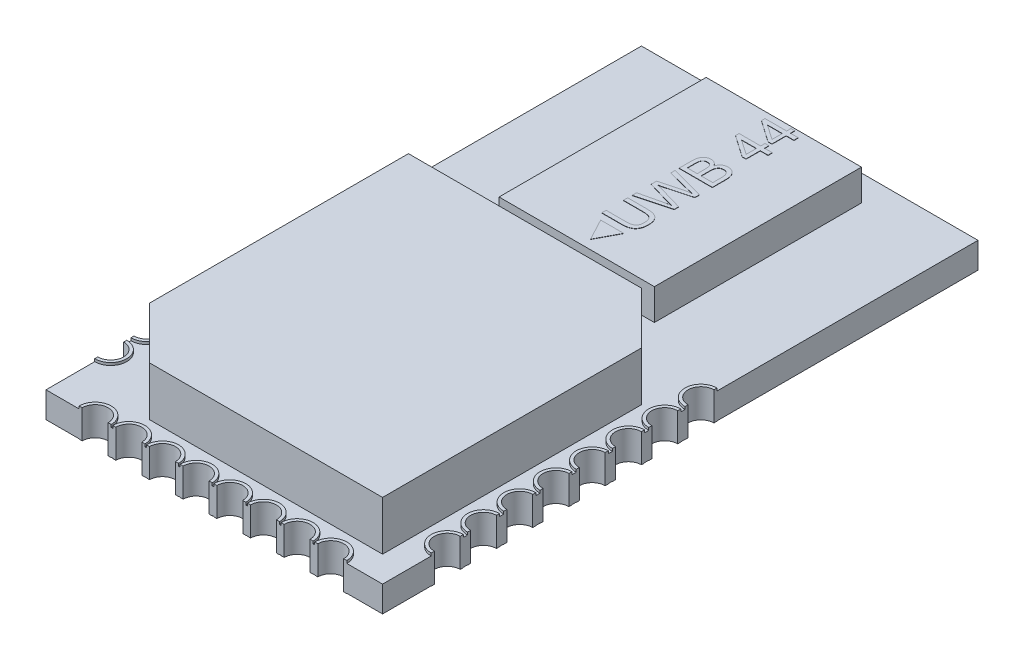
from build123d import *
from build123d.topology import SkipClean

# Parameters (mm, degrees)
SKETCH1_W               = 13
SKETCH1_H               = 23
BOSS_EXTRUDE1_DEPTH     = 1
BOSS_EXTRUDE2_DEPTH     = 1.9
BOSS_EXTRUDE3_DEPTH     = 1.2
BOSS_EXTRUDE4_DEPTH     = 0.01
BOSS_EXTRUDE5_DEPTH     = 0.01
CUT_EXTRUDE1_DEPTH      = 20.01
EXTRUDE_THIN1_DEPTH     = 0.1
SKETCH8_W               = 33.24
SKETCH8_H               = 43.24
SKETCH8_W_2             = 13
SKETCH8_H_2             = 23
CUT_EXTRUDE_THIN1_DEPTH = 10.1
BOSS_EXTRUDE7_DEPTH     = 0.01


# Read off the part's stored shape, not the designer's step: Extrude-Thin1
with BuildPart() as part:
    # Sketch1 → Boss-Extrude1 (new body)
    with BuildSketch(Plane(origin=(0, 0, 0), x_dir=(1, 0, 0), z_dir=(0, 1, 0))):
        Rectangle(SKETCH1_W, SKETCH1_H)
    extrude(amount=BOSS_EXTRUDE1_DEPTH)

    # Sketch2 → Boss-Extrude2 (add)
    with BuildSketch(Plane(origin=(0, 1, 0), x_dir=(1, 0, 0), z_dir=(0, 1, 0))):
        Polygon((-5.5, 1.5), (3.5, 1.5), (5.5, -0.5), (5.5, -10.5), (-3.5, -10.5), (-5.5, -8.5), align=None)
    extrude(amount=BOSS_EXTRUDE2_DEPTH)

    # Sketch3 → Boss-Extrude3 (add)
    with BuildSketch(Plane(origin=(0, 1, 0), x_dir=(1, 0, 0), z_dir=(0, 1, 0))):
        Polygon((0, 10.5), (3, 10.5), (3, 2.5), (-3, 2.5), (-3, 10.5), align=None)
    extrude(amount=BOSS_EXTRUDE3_DEPTH)

    # Sketch4 → Boss-Extrude4 (add)
    # profile 1 of 5: a face of its own
    with BuildSketch(Plane(origin=(0, 2.2, 0), x_dir=(1, 0, 0), z_dir=(0, 1, 0))):
        Polygon((0.507301778, 10.41661303), (0.507301778, 10.249839089), (0.807494871, 10.249839089), (0.807494871, 10.083065149), (0.507301778, 10.083065149), (0.507301778, 9.532711145), (0.357205232, 9.532711145), (-0.476664471, 10.112771757), (-0.476664471, 10.249839089), (0.357205232, 10.249839089), (0.357205232, 10.41661303), align=None)
        Polygon((0.357205232, 10.083065149), (-0.212432009, 10.083065149), (-0.212432009, 10.079677553), (0.357205232, 9.68697704), align=None, mode=Mode.SUBTRACT)
    # profile 2 of 5: a face of its own
    with BuildSketch(Plane(origin=(0, 2.2, 0), x_dir=(1, 0, 0), z_dir=(0, 1, 0))):
        Polygon((0.507301778, 9.415969386), (0.507301778, 9.249195446), (0.807494871, 9.249195446), (0.807494871, 9.082421505), (0.507301778, 9.082421505), (0.507301778, 8.532067501), (0.357205232, 8.532067501), (-0.476664471, 9.112128113), (-0.476664471, 9.249195446), (0.357205232, 9.249195446), (0.357205232, 9.415969386), align=None)
        Polygon((0.357205232, 9.082421505), (-0.212432009, 9.082421505), (-0.212432009, 9.079033909), (0.357205232, 8.686333396), align=None, mode=Mode.SUBTRACT)
    # profile 3 of 5: a face of its own
    with BuildSketch(Plane(origin=(0, 2.2, 0), x_dir=(1, 0, 0), z_dir=(0, 1, 0))):
        with BuildLine():
            add(Edge.make_bspline(
                [(0.119031198, 7.669533527), (0.122184999, 7.679573895), (0.128351413, 7.699205145), (0.139880255, 7.727166749), (0.152983017, 7.753057846), (0.167337098, 7.777099689), (0.182896489, 7.799401374), (0.200256825, 7.819569473), (0.218979443, 7.83782818), (0.239181553, 7.854083539), (0.260511538, 7.868213107), (0.282463439, 7.88100785), (0.305445224, 7.891257651), (0.329088928, 7.900005187), (0.353567066, 7.906812984), (0.37887444, 7.911377178), (0.404907229, 7.914386093), (0.422516467, 7.914795642), (0.431471752, 7.915003921)],
                knots=[0, 0, 0, 0, 1.176935759, 2.301182642, 3.378944261, 4.420526627, 5.431562247, 6.417057762, 7.392875982, 8.353528784, 9.3130013, 10.253136749, 11.19246832, 12.123976408, 13.071714693, 14.030399546, 14.998347744, 16, 16, 16, 16], degree=3))
            add(Edge.make_bspline(
                [(0.431471752, 7.915003921), (0.449245495, 7.914394337), (0.484412681, 7.913188214), (0.535877101, 7.902295879), (0.585128448, 7.885076772), (0.623767694, 7.864842862), (0.652796188, 7.845463595), (0.673412724, 7.829606429), (0.692580734, 7.812349023), (0.710086888, 7.793500976), (0.72606107, 7.77311316), (0.740301178, 7.751105806), (0.753423332, 7.727938634), (0.764911841, 7.703163851), (0.77526114, 7.676689785), (0.783625559, 7.647834738), (0.791305743, 7.616937483), (0.797171143, 7.583660954), (0.801809117, 7.548271804), (0.805259481, 7.51063663), (0.806926464, 7.470722742), (0.807301881, 7.443347525), (0.807494871, 7.429274819)],
                knots=[0, 0, 0, 0, 1.526595743, 3.02052723, 4.501503873, 6.001341024, 6.75529277, 7.500688863, 8.235648783, 8.970153244, 9.709652332, 10.459487233, 11.221862049, 11.996969686, 12.805534247, 13.663203375, 14.5779239, 15.541809012, 16.56633659, 17.646125667, 18.789950009, 20, 20, 20, 20], degree=3))
            Line((0.807494871, 7.429274819), (0.807494871, 6.931037672))
            Line((0.807494871, 6.931037672), (-0.476664471, 6.931037672))
            Line((-0.476664471, 6.931037672), (-0.476664471, 7.418069695))
            add(Edge.make_bspline(
                [(-0.476664471, 7.418069695), (-0.476389501, 7.437016578), (-0.475858828, 7.473582641), (-0.471115885, 7.526252215), (-0.46359021, 7.574684669), (-0.452271982, 7.618668901), (-0.438402878, 7.658511463), (-0.421244429, 7.694100401), (-0.400565612, 7.725101907), (-0.376835849, 7.75161371), (-0.351093684, 7.774073593), (-0.324865165, 7.79396363), (-0.297843316, 7.810939444), (-0.269929332, 7.824295155), (-0.241530026, 7.835326906), (-0.212307548, 7.842775226), (-0.182349054, 7.847353748), (-0.162155485, 7.847979114), (-0.151976456, 7.848294345)],
                knots=[0, 0, 0, 0, 1.496354045, 2.887850917, 4.173793582, 5.363669887, 6.470464623, 7.501527201, 8.475871733, 9.404091578, 10.303250637, 11.170534082, 12.002577431, 12.81885468, 13.611488736, 14.405309815, 15.196159996, 16, 16, 16, 16], degree=3))
            add(Edge.make_bspline(
                [(-0.151976456, 7.848294345), (-0.138295953, 7.847737252), (-0.111198448, 7.846633797), (-0.071522779, 7.837990237), (-0.033431935, 7.824016647), (0.002796985, 7.804362148), (0.03701615, 7.779290213), (0.067771718, 7.747970837), (0.096209812, 7.711591405), (0.111259719, 7.683855703), (0.119031198, 7.669533527)],
                knots=[0, 0, 0, 0, 0.957971959, 1.897492432, 2.831475797, 3.792845104, 4.776500828, 5.792250753, 6.859961322, 8, 8, 8, 8], degree=3))
        make_face()
        with BuildLine():
            Line((0.057012139, 7.097811612), (0.057012139, 7.382890817))
            add(Edge.make_bspline(
                [(0.057012139, 7.382890817), (0.056937656, 7.396963961), (0.056795058, 7.423907443), (0.055022036, 7.462598723), (0.051809219, 7.497698317), (0.048019521, 7.529772453), (0.041329283, 7.559404075), (0.03064038, 7.586960337), (0.015657067, 7.612520856), (0.000517643, 7.632363114), (-0.013959104, 7.64659345), (-0.02627591, 7.656147002), (-0.040256231, 7.663843608), (-0.055462478, 7.670525358), (-0.072236888, 7.675292056), (-0.090335693, 7.67904524), (-0.10989224, 7.681021923), (-0.123395331, 7.681350977), (-0.13034796, 7.681520404)],
                knots=[0, 0, 0, 0, 1.665380443, 3.188423883, 4.581606698, 5.836234077, 7.008124246, 8.166820965, 9.318153254, 10.504604963, 11.10794197, 11.716510321, 12.342538336, 12.991766527, 13.678023339, 14.4017504, 15.177074562, 16, 16, 16, 16], degree=3))
            add(Edge.make_bspline(
                [(-0.13034796, 7.681520404), (-0.137647845, 7.681349697), (-0.151843812, 7.681017725), (-0.172352019, 7.679059533), (-0.191325214, 7.675305179), (-0.208914193, 7.670442013), (-0.225134792, 7.663974858), (-0.239780712, 7.655833219), (-0.252949636, 7.646438199), (-0.268221461, 7.632086384), (-0.283977796, 7.611631324), (-0.299812333, 7.5851949), (-0.310699706, 7.556016484), (-0.317700951, 7.524323531), (-0.321356226, 7.489349982), (-0.324619772, 7.450436196), (-0.326346362, 7.406966484), (-0.326491743, 7.376464162), (-0.326567925, 7.360480569)],
                knots=[0, 0, 0, 0, 0.806146106, 1.567699262, 2.2711745, 2.939100804, 3.58025554, 4.194145681, 4.785054919, 5.36186379, 6.501724819, 7.623568821, 8.752849641, 9.923170717, 11.198430921, 12.632096495, 14.235177004, 16, 16, 16, 16], degree=3))
            Line((-0.326567925, 7.360480569), (-0.326567925, 7.097811612))
            Line((-0.326567925, 7.097811612), (0.057012139, 7.097811612))
        make_face(mode=Mode.SUBTRACT)
        with BuildLine():
            Line((0.657398325, 7.097811612), (0.657398325, 7.430838325))
            add(Edge.make_bspline(
                [(0.657398325, 7.430838325), (0.657159133, 7.44517278), (0.656699183, 7.47273697), (0.654310112, 7.512350959), (0.649521646, 7.548529985), (0.643333566, 7.581386069), (0.634513084, 7.610745791), (0.624698999, 7.637000925), (0.612341346, 7.659663089), (0.598130142, 7.678970539), (0.58218643, 7.695232268), (0.565159478, 7.709516036), (0.546500331, 7.721552357), (0.526411562, 7.731477581), (0.504890356, 7.739104501), (0.481941038, 7.744136606), (0.457645014, 7.747770768), (0.440867354, 7.748074196), (0.432253505, 7.74822998)],
                knots=[0, 0, 0, 0, 1.545772935, 2.972416902, 4.275813442, 5.478879039, 6.572407003, 7.577668998, 8.495542559, 9.345954806, 10.154003175, 10.945435332, 11.737753627, 12.541939228, 13.356528417, 14.192585806, 15.072052147, 16, 16, 16, 16], degree=3))
            add(Edge.make_bspline(
                [(0.432253505, 7.74822998), (0.423638214, 7.748088416), (0.406759263, 7.747811065), (0.382263517, 7.743925519), (0.359140323, 7.738357047), (0.337558127, 7.730149437), (0.317379379, 7.719752261), (0.298820904, 7.706856385), (0.281625498, 7.691796853), (0.265841065, 7.674273374), (0.251866188, 7.653485304), (0.239581745, 7.629391357), (0.229539378, 7.601421112), (0.221314659, 7.569833788), (0.214912839, 7.534549351), (0.210228361, 7.495659349), (0.207794132, 7.45301893), (0.207343651, 7.423370951), (0.207108685, 7.407906908)],
                knots=[0, 0, 0, 0, 0.887438978, 1.738657507, 2.551106764, 3.336290039, 4.113463126, 4.886132925, 5.66046215, 6.466019606, 7.310662729, 8.235983603, 9.247617521, 10.368639955, 11.598355836, 12.942610352, 14.40530095, 16, 16, 16, 16], degree=3))
            Line((0.207108685, 7.407906908), (0.207108685, 7.097811612))
            Line((0.207108685, 7.097811612), (0.657398325, 7.097811612))
        make_face(mode=Mode.SUBTRACT)
    # profile 4 of 5: a face of its own
    with BuildSketch(Plane(origin=(0, 2.2, 0), x_dir=(1, 0, 0), z_dir=(0, 1, 0))):
        with BuildLine():
            Line((-0.476664471, 6.780941125), (0.807494871, 6.432279356))
            Line((0.807494871, 6.432279356), (0.807494871, 6.255603212))
            Line((0.807494871, 6.255603212), (-0.203572144, 5.982771469))
            add(Edge.make_bspline(
                [(-0.203572144, 5.982771469), (-0.215718292, 5.979499612), (-0.238483912, 5.973367145), (-0.270395735, 5.965678977), (-0.297597647, 5.959337427), (-0.314305329, 5.956634921), (-0.321877408, 5.955410119)],
                knots=[0, 0, 0, 0, 1.242419329, 2.328676243, 3.242540285, 4, 4, 4, 4], degree=3))
            Line((-0.321877408, 5.955410119), (-0.321877408, 5.951761939))
            Line((-0.321877408, 5.951761939), (-0.169435603, 5.914498387))
            Line((-0.169435603, 5.914498387), (0.807494871, 5.630200935))
            Line((0.807494871, 5.630200935), (0.807494871, 5.457433556))
            Line((0.807494871, 5.457433556), (-0.476664471, 5.113201719))
            Line((-0.476664471, 5.113201719), (-0.476664471, 5.28727202))
            Line((-0.476664471, 5.28727202), (0.365543929, 5.486358411))
            add(Edge.make_bspline(
                [(0.365543929, 5.486358411), (0.37891831, 5.489495242), (0.40470356, 5.49554292), (0.441972969, 5.50411739), (0.476414824, 5.512038342), (0.508202872, 5.518851659), (0.53734138, 5.524477934), (0.56362458, 5.529548197), (0.58718483, 5.53345281), (0.601977757, 5.535628649), (0.608929648, 5.536651178)],
                knots=[0, 0, 0, 0, 1.326131356, 2.556725998, 3.691795554, 4.7377605, 5.694847041, 6.556605222, 7.321681004, 8, 8, 8, 8], degree=3))
            add(Edge.make_bspline(
                [(0.608929648, 5.536651178), (0.613097164, 5.537104278), (0.619172346, 5.537764782), (0.625259212, 5.538305483), (0.627170548, 5.538475268)],
                knots=[0, 0, 0, 0, 1.371980523, 2, 2, 2, 2], degree=3))
            Line((0.627170548, 5.538475268), (0.627170548, 5.542123448))
            add(Edge.make_bspline(
                [(0.627170548, 5.542123448), (0.613782169, 5.545025323), (0.58801772, 5.550609661), (0.55094988, 5.559510723), (0.516684694, 5.566952843), (0.485540177, 5.574864843), (0.457194076, 5.581339827), (0.431885184, 5.587994659), (0.409456986, 5.593924553), (0.395506356, 5.597871018), (0.388996514, 5.599712574)],
                knots=[0, 0, 0, 0, 1.341520923, 2.581608101, 3.733077067, 4.774954608, 5.728156824, 6.580234416, 7.337488687, 8, 8, 8, 8], degree=3))
            Line((0.388996514, 5.599712574), (-0.476664471, 5.855345755))
            Line((-0.476664471, 5.855345755), (-0.476664471, 6.062510259))
            Line((-0.476664471, 6.062510259), (0.171929807, 6.239446987))
            add(Edge.make_bspline(
                [(0.171929807, 6.239446987), (0.211560727, 6.250042197), (0.289322757, 6.270831648), (0.404938396, 6.297046451), (0.517024449, 6.318967168), (0.590906035, 6.33012554), (0.627170548, 6.335602587)],
                knots=[0, 0, 0, 0, 1.057211854, 2.074414073, 3.054833036, 4, 4, 4, 4], degree=3))
            Line((0.627170548, 6.335602587), (0.627170548, 6.338990183))
            add(Edge.make_bspline(
                [(0.627170548, 6.338990183), (0.618138408, 6.34073415), (0.59928814, 6.344373848), (0.569853331, 6.34991419), (0.538326989, 6.35695783), (0.504446876, 6.364014745), (0.468453106, 6.372516704), (0.4302603, 6.381656998), (0.389713273, 6.391188719), (0.36205928, 6.398188044), (0.347824197, 6.401790995)],
                knots=[0, 0, 0, 0, 0.770963193, 1.609016692, 2.509968375, 3.47803422, 4.5092907, 5.609323521, 6.769382853, 8, 8, 8, 8], degree=3))
            Line((0.347824197, 6.401790995), (-0.476664471, 6.608955499))
            Line((-0.476664471, 6.608955499), (-0.476664471, 6.780941125))
        make_face()
    # profile 5 of 5: a face of its own
    with BuildSketch(Plane(origin=(0, 2.2, 0), x_dir=(1, 0, 0), z_dir=(0, 1, 0))):
        with BuildLine():
            add(Edge.make_bspline(
                [(0.263134306, 4.946427779), (0.27929059, 4.946221964), (0.311004988, 4.945817954), (0.3576195, 4.944293519), (0.402243822, 4.9402921), (0.445571669, 4.936018465), (0.48840601, 4.928537227), (0.531364939, 4.916442657), (0.57471868, 4.899424403), (0.610986793, 4.882300749), (0.639686947, 4.865884062), (0.660558346, 4.851555333), (0.680398815, 4.835226449), (0.699508964, 4.817393323), (0.717101763, 4.797243785), (0.734552741, 4.775978674), (0.750578562, 4.752427176), (0.765715238, 4.727153976), (0.779714872, 4.699958404), (0.791655658, 4.670371601), (0.801679693, 4.638628558), (0.810182719, 4.604811529), (0.816173242, 4.5687053), (0.821013864, 4.530473856), (0.823453523, 4.490002203), (0.823928839, 4.462351515), (0.824172265, 4.448190631)],
                knots=[0, 0, 0, 0, 1.341018874, 2.63238777, 3.869224111, 5.058573692, 6.244970265, 7.472845662, 8.75537126, 10.106370432, 10.797555096, 11.497406991, 12.204461668, 12.928582508, 13.663742954, 14.42255697, 15.210401203, 16.025127848, 16.866588318, 17.746096498, 18.669419342, 19.62754459, 20.637297154, 21.704911701, 22.824605117, 24, 24, 24, 24], degree=3))
            add(Edge.make_bspline(
                [(0.824172265, 4.448190631), (0.824064261, 4.434373902), (0.823853481, 4.407409222), (0.820987682, 4.367962368), (0.817356549, 4.330527466), (0.811600746, 4.295104439), (0.804002379, 4.261918036), (0.795241164, 4.230588717), (0.784558656, 4.201426468), (0.772242728, 4.174228743), (0.758686127, 4.148930614), (0.744074798, 4.125479807), (0.728633019, 4.103685801), (0.712270911, 4.08357179), (0.694782399, 4.065336219), (0.676401848, 4.048795904), (0.657158559, 4.033831601), (0.630079797, 4.016773202), (0.59531826, 3.998386962), (0.552239615, 3.981028904), (0.508622741, 3.967041689), (0.463507923, 3.958485833), (0.416794706, 3.952992129), (0.367947695, 3.948856205), (0.316411261, 3.946129917), (0.281205095, 3.945901419), (0.263134306, 3.945784135)],
                knots=[0, 0, 0, 0, 1.137398152, 2.219742185, 3.255227878, 4.233508365, 5.172188699, 6.05735518, 6.910385055, 7.726642151, 8.513803864, 9.271934364, 10.000263162, 10.711823657, 11.404846856, 12.078405527, 12.74647376, 13.409121862, 14.711249829, 15.978315633, 17.229292092, 18.4762548, 19.751930892, 21.101400484, 22.512192971, 24, 24, 24, 24], degree=3))
            Line((0.263134306, 3.945784135), (-0.476664471, 3.945784135))
            Line((-0.476664471, 3.945784135), (-0.476664471, 4.112558076))
            Line((-0.476664471, 4.112558076), (0.262352553, 4.112558076))
            add(Edge.make_bspline(
                [(0.262352553, 4.112558076), (0.280859023, 4.112740225), (0.316683928, 4.113092829), (0.368324087, 4.11628471), (0.416094959, 4.121134692), (0.460392041, 4.12801388), (0.502096074, 4.139491767), (0.540790301, 4.158387742), (0.576955039, 4.184011968), (0.604884458, 4.210219115), (0.62479038, 4.235208275), (0.638275958, 4.256515247), (0.649456424, 4.280439098), (0.658448982, 4.306766877), (0.66551864, 4.335366517), (0.670307446, 4.366326258), (0.673546313, 4.399653594), (0.673895526, 4.42273194), (0.674075719, 4.434640249)],
                knots=[0, 0, 0, 0, 1.462434425, 2.830986988, 4.087148213, 5.256322149, 6.370876296, 7.49152331, 8.639896084, 9.863466137, 10.503503123, 11.160578777, 11.851494306, 12.585276792, 13.356140811, 14.176606368, 15.05913821, 16, 16, 16, 16], degree=3))
            add(Edge.make_bspline(
                [(0.674075719, 4.434640249), (0.673925668, 4.446716655), (0.67363498, 4.470111939), (0.671404105, 4.504065174), (0.667093225, 4.53560252), (0.661873189, 4.564937231), (0.654503311, 4.591830149), (0.6457176, 4.616581906), (0.635063918, 4.638881711), (0.622967544, 4.6590852), (0.6092159, 4.676902363), (0.59502484, 4.693625857), (0.5790986, 4.708118784), (0.562658142, 4.721596003), (0.544541633, 4.732778971), (0.525712457, 4.74270122), (0.505626649, 4.750864561), (0.476673589, 4.759609401), (0.436732301, 4.767807813), (0.384123497, 4.774615155), (0.32531835, 4.779145976), (0.2839902, 4.779479316), (0.262352553, 4.779653838)],
                knots=[0, 0, 0, 0, 1.149395797, 2.226692445, 3.23572014, 4.17777166, 5.060186344, 5.88656652, 6.674201227, 7.408625828, 8.122905983, 8.814285472, 9.492793073, 10.169333615, 10.83446353, 11.514832057, 12.19339002, 12.894195169, 14.390815968, 16.067429753, 17.941074819, 20, 20, 20, 20], degree=3))
            Line((0.262352553, 4.779653838), (-0.476664471, 4.779653838))
            Line((-0.476664471, 4.779653838), (-0.476664471, 4.946427779))
            Line((-0.476664471, 4.946427779), (0.263134306, 4.946427779))
        make_face()
    extrude(amount=BOSS_EXTRUDE4_DEPTH)

    # Sketch5 → Boss-Extrude5 (add)
    with BuildSketch(Plane(origin=(0, 2.2, 0), x_dir=(1, 0, 0), z_dir=(0, 1, 0))):
        Polygon((0.63326168, 3.680352011), (-0.25599072, 3.680352011), (0.18863548, 2.844704038), align=None)
    extrude(amount=BOSS_EXTRUDE5_DEPTH)

    # Sketch7 → Cut-Extrude1 (cut)
    with BuildSketch(Plane(origin=(0, 1, 0), x_dir=(1, 0, 0), z_dir=(0, 1, 0))):
        with BuildLine():
            ThreePointArc((-6.5, 1.3), (-7, 0.8), (-6.5, 0.3))
            Line((-6.5, 0.3), (-6.5, 1.3))
        make_face()
        with BuildLine():
            Line((-6.5, 1.3), (-6.5, 0.3))
            ThreePointArc((-6.5, 0.3), (-6.146446609, 0.446446609), (-6, 0.8))
            ThreePointArc((-6, 0.8), (-6.146446609, 1.153553391), (-6.5, 1.3))
        make_face()
        with BuildLine():
            ThreePointArc((-6.5, -0.1), (-7, -0.6), (-6.5, -1.1))
            Line((-6.5, -1.1), (-6.5, -0.1))
        make_face()
        with BuildLine():
            Line((-6.5, -0.1), (-6.5, -1.1))
            ThreePointArc((-6.5, -1.1), (-6.146446609, -0.953553391), (-6, -0.6))
            ThreePointArc((-6, -0.6), (-6.146446609, -0.246446609), (-6.5, -0.1))
        make_face()
        with BuildLine():
            ThreePointArc((-6.5, -1.5), (-7, -2), (-6.5, -2.5))
            Line((-6.5, -2.5), (-6.5, -1.5))
        make_face()
        with BuildLine():
            Line((-6.5, -1.5), (-6.5, -2.5))
            ThreePointArc((-6.5, -2.5), (-6.146446609, -2.353553391), (-6, -2))
            ThreePointArc((-6, -2), (-6.146446609, -1.646446609), (-6.5, -1.5))
        make_face()
        with BuildLine():
            ThreePointArc((-6.5, -2.9), (-7, -3.4), (-6.5, -3.9))
            Line((-6.5, -3.9), (-6.5, -2.9))
        make_face()
        with BuildLine():
            Line((-6.5, -2.9), (-6.5, -3.9))
            ThreePointArc((-6.5, -3.9), (-6.146446609, -3.753553391), (-6, -3.4))
            ThreePointArc((-6, -3.4), (-6.146446609, -3.046446609), (-6.5, -2.9))
        make_face()
        with BuildLine():
            ThreePointArc((-6.5, -5.7), (-7, -6.2), (-6.5, -6.7))
            Line((-6.5, -6.7), (-6.5, -5.7))
        make_face()
        with BuildLine():
            Line((-6.5, -5.7), (-6.5, -6.7))
            ThreePointArc((-6.5, -6.7), (-6.146446609, -6.553553391), (-6, -6.2))
            ThreePointArc((-6, -6.2), (-6.146446609, -5.846446609), (-6.5, -5.7))
        make_face()
        with BuildLine():
            ThreePointArc((-6.5, -4.3), (-7, -4.8), (-6.5, -5.3))
            Line((-6.5, -5.3), (-6.5, -4.3))
        make_face()
        with BuildLine():
            Line((-6.5, -4.3), (-6.5, -5.3))
            ThreePointArc((-6.5, -5.3), (-6.146446609, -5.153553391), (-6, -4.8))
            ThreePointArc((-6, -4.8), (-6.146446609, -4.446446609), (-6.5, -4.3))
        make_face()
        with BuildLine():
            ThreePointArc((-6.5, -7.1), (-7, -7.6), (-6.5, -8.1))
            Line((-6.5, -8.1), (-6.5, -7.1))
        make_face()
        with BuildLine():
            Line((-6.5, -7.1), (-6.5, -8.1))
            ThreePointArc((-6.5, -8.1), (-6.146446609, -7.953553391), (-6, -7.6))
            ThreePointArc((-6, -7.6), (-6.146446609, -7.246446609), (-6.5, -7.1))
        make_face()
        with BuildLine():
            ThreePointArc((-6.5, -8.5), (-7, -9), (-6.5, -9.5))
            Line((-6.5, -9.5), (-6.5, -8.5))
        make_face()
        with BuildLine():
            Line((-6.5, -8.5), (-6.5, -9.5))
            ThreePointArc((-6.5, -9.5), (-6.146446609, -9.353553391), (-6, -9))
            ThreePointArc((-6, -9), (-6.146446609, -8.646446609), (-6.5, -8.5))
        make_face()
        with BuildLine():
            ThreePointArc((-5.1, -11.5), (-4.6, -12), (-4.1, -11.5))
            Line((-4.1, -11.5), (-5.1, -11.5))
        make_face()
        with BuildLine():
            Line((-5.1, -11.5), (-4.1, -11.5))
            ThreePointArc((-4.1, -11.5), (-4.6, -11), (-5.1, -11.5))
        make_face()
        with BuildLine():
            ThreePointArc((-3.8, -11.5), (-3.3, -12), (-2.8, -11.5))
            Line((-2.8, -11.5), (-3.8, -11.5))
        make_face()
        with BuildLine():
            Line((-3.8, -11.5), (-2.8, -11.5))
            ThreePointArc((-2.8, -11.5), (-3.3, -11), (-3.8, -11.5))
        make_face()
        with BuildLine():
            ThreePointArc((-2.5, -11.5), (-2, -12), (-1.5, -11.5))
            Line((-1.5, -11.5), (-2.5, -11.5))
        make_face()
        with BuildLine():
            Line((-2.5, -11.5), (-1.5, -11.5))
            ThreePointArc((-1.5, -11.5), (-2, -11), (-2.5, -11.5))
        make_face()
        with BuildLine():
            ThreePointArc((-1.2, -11.5), (-0.7, -12), (-0.2, -11.5))
            Line((-0.2, -11.5), (-1.2, -11.5))
        make_face()
        with BuildLine():
            Line((-1.2, -11.5), (-0.2, -11.5))
            ThreePointArc((-0.2, -11.5), (-0.7, -11), (-1.2, -11.5))
        make_face()
        with BuildLine():
            ThreePointArc((0.1, -11.5), (0.6, -12), (1.1, -11.5))
            Line((1.1, -11.5), (0.1, -11.5))
        make_face()
        with BuildLine():
            Line((0.1, -11.5), (1.1, -11.5))
            ThreePointArc((1.1, -11.5), (0.6, -11), (0.1, -11.5))
        make_face()
        with BuildLine():
            ThreePointArc((1.4, -11.5), (1.9, -12), (2.4, -11.5))
            Line((2.4, -11.5), (1.4, -11.5))
        make_face()
        with BuildLine():
            Line((1.4, -11.5), (2.4, -11.5))
            ThreePointArc((2.4, -11.5), (1.9, -11), (1.4, -11.5))
        make_face()
        with BuildLine():
            ThreePointArc((2.7, -11.5), (3.2, -12), (3.7, -11.5))
            Line((3.7, -11.5), (2.7, -11.5))
        make_face()
        with BuildLine():
            Line((2.7, -11.5), (3.7, -11.5))
            ThreePointArc((3.7, -11.5), (3.2, -11), (2.7, -11.5))
        make_face()
        with BuildLine():
            ThreePointArc((6.5, -8.5), (6, -9), (6.5, -9.5))
            Line((6.5, -9.5), (6.5, -8.5))
        make_face()
        with BuildLine():
            Line((6.5, -8.5), (6.5, -9.5))
            ThreePointArc((6.5, -9.5), (6.853553391, -9.353553391), (7, -9))
            ThreePointArc((7, -9), (6.853553391, -8.646446609), (6.5, -8.5))
        make_face()
        with BuildLine():
            ThreePointArc((4, -11.5), (4.5, -12), (5, -11.5))
            Line((5, -11.5), (4.5, -11.5))
            Line((4.5, -11.5), (4, -11.5))
        make_face()
        with BuildLine():
            Line((4.5, -11.5), (5, -11.5))
            ThreePointArc((5, -11.5), (4.5, -11), (4, -11.5))
            Line((4, -11.5), (4.5, -11.5))
        make_face()
        with BuildLine():
            ThreePointArc((6.5, -7.1), (6, -7.6), (6.5, -8.1))
            Line((6.5, -8.1), (6.5, -7.1))
        make_face()
        with BuildLine():
            Line((6.5, -7.1), (6.5, -8.1))
            ThreePointArc((6.5, -8.1), (6.853553391, -7.953553391), (7, -7.6))
            ThreePointArc((7, -7.6), (6.853553391, -7.246446609), (6.5, -7.1))
        make_face()
        with BuildLine():
            ThreePointArc((6.5, -5.7), (6, -6.2), (6.5, -6.7))
            Line((6.5, -6.7), (6.5, -5.7))
        make_face()
        with BuildLine():
            Line((6.5, -5.7), (6.5, -6.7))
            ThreePointArc((6.5, -6.7), (6.853553391, -6.553553391), (7, -6.2))
            ThreePointArc((7, -6.2), (6.853553391, -5.846446609), (6.5, -5.7))
        make_face()
        with BuildLine():
            ThreePointArc((6.5, -4.3), (6, -4.8), (6.5, -5.3))
            Line((6.5, -5.3), (6.5, -4.3))
        make_face()
        with BuildLine():
            Line((6.5, -4.3), (6.5, -5.3))
            ThreePointArc((6.5, -5.3), (6.853553391, -5.153553391), (7, -4.8))
            ThreePointArc((7, -4.8), (6.853553391, -4.446446609), (6.5, -4.3))
        make_face()
        with BuildLine():
            ThreePointArc((6.5, -2.9), (6, -3.4), (6.5, -3.9))
            Line((6.5, -3.9), (6.5, -2.9))
        make_face()
        with BuildLine():
            Line((6.5, -2.9), (6.5, -3.9))
            ThreePointArc((6.5, -3.9), (6.853553391, -3.753553391), (7, -3.4))
            ThreePointArc((7, -3.4), (6.853553391, -3.046446609), (6.5, -2.9))
        make_face()
        with BuildLine():
            ThreePointArc((6.5, 1.3), (6, 0.8), (6.5, 0.3))
            Line((6.5, 0.3), (6.5, 1.3))
        make_face()
        with BuildLine():
            Line((6.5, 1.3), (6.5, 0.3))
            ThreePointArc((6.5, 0.3), (6.853553391, 0.446446609), (7, 0.8))
            ThreePointArc((7, 0.8), (6.853553391, 1.153553391), (6.5, 1.3))
        make_face()
        with BuildLine():
            ThreePointArc((6.5, -0.1), (6, -0.6), (6.5, -1.1))
            Line((6.5, -1.1), (6.5, -0.1))
        make_face()
        with BuildLine():
            Line((6.5, -0.1), (6.5, -1.1))
            ThreePointArc((6.5, -1.1), (6.853553391, -0.953553391), (7, -0.6))
            ThreePointArc((7, -0.6), (6.853553391, -0.246446609), (6.5, -0.1))
        make_face()
        with BuildLine():
            ThreePointArc((6.5, -1.5), (6, -2), (6.5, -2.5))
            Line((6.5, -2.5), (6.5, -1.5))
        make_face()
        with BuildLine():
            Line((6.5, -1.5), (6.5, -2.5))
            ThreePointArc((6.5, -2.5), (6.853553391, -2.353553391), (7, -2))
            ThreePointArc((7, -2), (6.853553391, -1.646446609), (6.5, -1.5))
        make_face()
    extrude(amount=-CUT_EXTRUDE1_DEPTH, mode=Mode.SUBTRACT)

    # Extrude-Thin1 outline → Extrude-Thin1 (add)
    # profile 1 of 24: a face of its own
    with BuildSketch(Plane(origin=(0, 1, 0), x_dir=(1, 0, 0), z_dir=(0, 1, 0))):
        with BuildLine():
            ThreePointArc((-6.62, 0.191723747), (-5.88, 0.8), (-6.62, 1.408276253))
            Line((-6.62, 1.408276253), (-6.62, 0.191723747))
        make_face()
        with BuildLine():
            ThreePointArc((-6.5, 1.3), (-6, 0.8), (-6.5, 0.3))
            Line((-6.5, 0.3), (-6.5, 1.3))
        make_face(mode=Mode.SUBTRACT)
    # profile 2 of 24: a face of its own
    with BuildSketch(Plane(origin=(0, 1, 0), x_dir=(1, 0, 0), z_dir=(0, 1, 0))):
        with BuildLine():
            Line((-6.62, 0.008276253), (-6.62, -1.208276253))
            ThreePointArc((-6.62, -1.208276253), (-5.88, -0.6), (-6.62, 0.008276253))
        make_face()
        with BuildLine():
            ThreePointArc((-6.5, -0.1), (-6, -0.6), (-6.5, -1.1))
            Line((-6.5, -1.1), (-6.5, -0.1))
        make_face(mode=Mode.SUBTRACT)
    # profile 3 of 24: a face of its own
    with BuildSketch(Plane(origin=(0, 1, 0), x_dir=(1, 0, 0), z_dir=(0, 1, 0))):
        with BuildLine():
            Line((-6.62, -1.391723747), (-6.62, -2.608276253))
            ThreePointArc((-6.62, -2.608276253), (-5.88, -2), (-6.62, -1.391723747))
        make_face()
        with BuildLine():
            ThreePointArc((-6.5, -1.5), (-6, -2), (-6.5, -2.5))
            Line((-6.5, -2.5), (-6.5, -1.5))
        make_face(mode=Mode.SUBTRACT)
    # profile 4 of 24: a face of its own
    with BuildSketch(Plane(origin=(0, 1, 0), x_dir=(1, 0, 0), z_dir=(0, 1, 0))):
        with BuildLine():
            Line((-6.62, -2.791723747), (-6.62, -4.008276253))
            ThreePointArc((-6.62, -4.008276253), (-5.88, -3.4), (-6.62, -2.791723747))
        make_face()
        with BuildLine():
            ThreePointArc((-6.5, -2.9), (-6, -3.4), (-6.5, -3.9))
            Line((-6.5, -3.9), (-6.5, -2.9))
        make_face(mode=Mode.SUBTRACT)
    # profile 5 of 24: a face of its own
    with BuildSketch(Plane(origin=(0, 1, 0), x_dir=(1, 0, 0), z_dir=(0, 1, 0))):
        with BuildLine():
            Line((-6.62, -4.191723747), (-6.62, -5.408276253))
            ThreePointArc((-6.62, -5.408276253), (-5.88, -4.8), (-6.62, -4.191723747))
        make_face()
        with BuildLine():
            ThreePointArc((-6.5, -4.3), (-6, -4.8), (-6.5, -5.3))
            Line((-6.5, -5.3), (-6.5, -4.3))
        make_face(mode=Mode.SUBTRACT)
    # profile 6 of 24: a face of its own
    with BuildSketch(Plane(origin=(0, 1, 0), x_dir=(1, 0, 0), z_dir=(0, 1, 0))):
        with BuildLine():
            Line((-6.62, -5.591723747), (-6.62, -6.808276253))
            ThreePointArc((-6.62, -6.808276253), (-5.88, -6.2), (-6.62, -5.591723747))
        make_face()
        with BuildLine():
            ThreePointArc((-6.5, -5.7), (-6, -6.2), (-6.5, -6.7))
            Line((-6.5, -6.7), (-6.5, -5.7))
        make_face(mode=Mode.SUBTRACT)
    # profile 7 of 24: a face of its own
    with BuildSketch(Plane(origin=(0, 1, 0), x_dir=(1, 0, 0), z_dir=(0, 1, 0))):
        with BuildLine():
            Line((-6.62, -8.391723747), (-6.62, -9.608276253))
            ThreePointArc((-6.62, -9.608276253), (-5.88, -9), (-6.62, -8.391723747))
        make_face()
        with BuildLine():
            ThreePointArc((-6.5, -8.5), (-6, -9), (-6.5, -9.5))
            Line((-6.5, -9.5), (-6.5, -8.5))
        make_face(mode=Mode.SUBTRACT)
    # profile 8 of 24: a face of its own
    with BuildSketch(Plane(origin=(0, 1, 0), x_dir=(1, 0, 0), z_dir=(0, 1, 0))):
        with BuildLine():
            Line((-6.62, -6.991723747), (-6.62, -8.208276253))
            ThreePointArc((-6.62, -8.208276253), (-5.88, -7.6), (-6.62, -6.991723747))
        make_face()
        with BuildLine():
            ThreePointArc((-6.5, -7.1), (-6, -7.6), (-6.5, -8.1))
            Line((-6.5, -8.1), (-6.5, -7.1))
        make_face(mode=Mode.SUBTRACT)
    # profile 9 of 24: a face of its own
    with BuildSketch(Plane(origin=(0, 1, 0), x_dir=(1, 0, 0), z_dir=(0, 1, 0))):
        with BuildLine():
            Line((-5.208276253, -11.62), (-3.991723747, -11.62))
            ThreePointArc((-3.991723747, -11.62), (-4.6, -10.88), (-5.208276253, -11.62))
        make_face()
        with BuildLine():
            ThreePointArc((-5.1, -11.5), (-4.6, -11), (-4.1, -11.5))
            Line((-4.1, -11.5), (-5.1, -11.5))
        make_face(mode=Mode.SUBTRACT)
    # profile 10 of 24: a face of its own
    with BuildSketch(Plane(origin=(0, 1, 0), x_dir=(1, 0, 0), z_dir=(0, 1, 0))):
        with BuildLine():
            Line((-3.908276253, -11.62), (-2.691723747, -11.62))
            ThreePointArc((-2.691723747, -11.62), (-3.3, -10.88), (-3.908276253, -11.62))
        make_face()
        with BuildLine():
            ThreePointArc((-3.8, -11.5), (-3.3, -11), (-2.8, -11.5))
            Line((-2.8, -11.5), (-3.8, -11.5))
        make_face(mode=Mode.SUBTRACT)
    # profile 11 of 24: a face of its own
    with BuildSketch(Plane(origin=(0, 1, 0), x_dir=(1, 0, 0), z_dir=(0, 1, 0))):
        with BuildLine():
            Line((-2.608276253, -11.62), (-1.391723747, -11.62))
            ThreePointArc((-1.391723747, -11.62), (-2, -10.88), (-2.608276253, -11.62))
        make_face()
        with BuildLine():
            ThreePointArc((-2.5, -11.5), (-2, -11), (-1.5, -11.5))
            Line((-1.5, -11.5), (-2.5, -11.5))
        make_face(mode=Mode.SUBTRACT)
    # profile 12 of 24: a face of its own
    with BuildSketch(Plane(origin=(0, 1, 0), x_dir=(1, 0, 0), z_dir=(0, 1, 0))):
        with BuildLine():
            Line((-1.308276253, -11.62), (-0.091723747, -11.62))
            ThreePointArc((-0.091723747, -11.62), (-0.7, -10.88), (-1.308276253, -11.62))
        make_face()
        with BuildLine():
            ThreePointArc((-1.2, -11.5), (-0.7, -11), (-0.2, -11.5))
            Line((-0.2, -11.5), (-1.2, -11.5))
        make_face(mode=Mode.SUBTRACT)
    # profile 13 of 24: a face of its own
    with BuildSketch(Plane(origin=(0, 1, 0), x_dir=(1, 0, 0), z_dir=(0, 1, 0))):
        with BuildLine():
            Line((-0.008276253, -11.62), (1.208276253, -11.62))
            ThreePointArc((1.208276253, -11.62), (0.6, -10.88), (-0.008276253, -11.62))
        make_face()
        with BuildLine():
            ThreePointArc((0.1, -11.5), (0.6, -11), (1.1, -11.5))
            Line((1.1, -11.5), (0.1, -11.5))
        make_face(mode=Mode.SUBTRACT)
    # profile 14 of 24: a face of its own
    with BuildSketch(Plane(origin=(0, 1, 0), x_dir=(1, 0, 0), z_dir=(0, 1, 0))):
        with BuildLine():
            Line((1.291723747, -11.62), (2.508276253, -11.62))
            ThreePointArc((2.508276253, -11.62), (1.9, -10.88), (1.291723747, -11.62))
        make_face()
        with BuildLine():
            ThreePointArc((1.4, -11.5), (1.9, -11), (2.4, -11.5))
            Line((2.4, -11.5), (1.4, -11.5))
        make_face(mode=Mode.SUBTRACT)
    # profile 15 of 24: a face of its own
    with BuildSketch(Plane(origin=(0, 1, 0), x_dir=(1, 0, 0), z_dir=(0, 1, 0))):
        with BuildLine():
            Line((2.591723747, -11.62), (3.808276253, -11.62))
            ThreePointArc((3.808276253, -11.62), (3.2, -10.88), (2.591723747, -11.62))
        make_face()
        with BuildLine():
            ThreePointArc((2.7, -11.5), (3.2, -11), (3.7, -11.5))
            Line((3.7, -11.5), (2.7, -11.5))
        make_face(mode=Mode.SUBTRACT)
    # profile 16 of 24: a face of its own
    with BuildSketch(Plane(origin=(0, 1, 0), x_dir=(1, 0, 0), z_dir=(0, 1, 0))):
        with BuildLine():
            Line((3.891723747, -11.62), (5.108276253, -11.62))
            ThreePointArc((5.108276253, -11.62), (4.5, -10.88), (3.891723747, -11.62))
        make_face()
        with BuildLine():
            ThreePointArc((4, -11.5), (4.5, -11), (5, -11.5))
            Line((5, -11.5), (4, -11.5))
        make_face(mode=Mode.SUBTRACT)
    # profile 17 of 24: a face of its own
    with BuildSketch(Plane(origin=(0, 1, 0), x_dir=(1, 0, 0), z_dir=(0, 1, 0))):
        with BuildLine():
            Line((6.62, -9.608276253), (6.62, -8.391723747))
            ThreePointArc((6.62, -8.391723747), (5.88, -9), (6.62, -9.608276253))
        make_face()
        with BuildLine():
            ThreePointArc((6.5, -9.5), (6, -9), (6.5, -8.5))
            Line((6.5, -8.5), (6.5, -9.5))
        make_face(mode=Mode.SUBTRACT)
    # profile 18 of 24: a face of its own
    with BuildSketch(Plane(origin=(0, 1, 0), x_dir=(1, 0, 0), z_dir=(0, 1, 0))):
        with BuildLine():
            Line((6.62, -8.208276253), (6.62, -6.991723747))
            ThreePointArc((6.62, -6.991723747), (5.88, -7.6), (6.62, -8.208276253))
        make_face()
        with BuildLine():
            ThreePointArc((6.5, -8.1), (6, -7.6), (6.5, -7.1))
            Line((6.5, -7.1), (6.5, -8.1))
        make_face(mode=Mode.SUBTRACT)
    # profile 19 of 24: a face of its own
    with BuildSketch(Plane(origin=(0, 1, 0), x_dir=(1, 0, 0), z_dir=(0, 1, 0))):
        with BuildLine():
            Line((6.62, -6.808276253), (6.62, -5.591723747))
            ThreePointArc((6.62, -5.591723747), (5.88, -6.2), (6.62, -6.808276253))
        make_face()
        with BuildLine():
            ThreePointArc((6.5, -6.7), (6, -6.2), (6.5, -5.7))
            Line((6.5, -5.7), (6.5, -6.7))
        make_face(mode=Mode.SUBTRACT)
    # profile 20 of 24: a face of its own
    with BuildSketch(Plane(origin=(0, 1, 0), x_dir=(1, 0, 0), z_dir=(0, 1, 0))):
        with BuildLine():
            Line((6.62, -5.408276253), (6.62, -4.191723747))
            ThreePointArc((6.62, -4.191723747), (5.88, -4.8), (6.62, -5.408276253))
        make_face()
        with BuildLine():
            ThreePointArc((6.5, -5.3), (6, -4.8), (6.5, -4.3))
            Line((6.5, -4.3), (6.5, -5.3))
        make_face(mode=Mode.SUBTRACT)
    # profile 21 of 24: a face of its own
    with BuildSketch(Plane(origin=(0, 1, 0), x_dir=(1, 0, 0), z_dir=(0, 1, 0))):
        with BuildLine():
            Line((6.62, -4.008276253), (6.62, -2.791723747))
            ThreePointArc((6.62, -2.791723747), (5.88, -3.4), (6.62, -4.008276253))
        make_face()
        with BuildLine():
            ThreePointArc((6.5, -3.9), (6, -3.4), (6.5, -2.9))
            Line((6.5, -2.9), (6.5, -3.9))
        make_face(mode=Mode.SUBTRACT)
    # profile 22 of 24: a face of its own
    with BuildSketch(Plane(origin=(0, 1, 0), x_dir=(1, 0, 0), z_dir=(0, 1, 0))):
        with BuildLine():
            Line((6.62, -2.608276253), (6.62, -1.391723747))
            ThreePointArc((6.62, -1.391723747), (5.88, -2), (6.62, -2.608276253))
        make_face()
        with BuildLine():
            ThreePointArc((6.5, -2.5), (6, -2), (6.5, -1.5))
            Line((6.5, -1.5), (6.5, -2.5))
        make_face(mode=Mode.SUBTRACT)
    # profile 23 of 24: a face of its own
    with BuildSketch(Plane(origin=(0, 1, 0), x_dir=(1, 0, 0), z_dir=(0, 1, 0))):
        with BuildLine():
            Line((6.62, -1.208276253), (6.62, 0.008276253))
            ThreePointArc((6.62, 0.008276253), (5.88, -0.6), (6.62, -1.208276253))
        make_face()
        with BuildLine():
            ThreePointArc((6.5, -1.1), (6, -0.6), (6.5, -0.1))
            Line((6.5, -0.1), (6.5, -1.1))
        make_face(mode=Mode.SUBTRACT)
    # profile 24 of 24: a face of its own
    with BuildSketch(Plane(origin=(0, 1, 0), x_dir=(1, 0, 0), z_dir=(0, 1, 0))):
        with BuildLine():
            Line((6.62, 0.191723747), (6.62, 1.408276253))
            ThreePointArc((6.62, 1.408276253), (5.88, 0.8), (6.62, 0.191723747))
        make_face()
        with BuildLine():
            ThreePointArc((6.5, 0.3), (6, 0.8), (6.5, 1.3))
            Line((6.5, 1.3), (6.5, 0.3))
        make_face(mode=Mode.SUBTRACT)
    extrude(amount=EXTRUDE_THIN1_DEPTH)

    # Sketch8 → Cut-Extrude-Thin1 (cut)
    with BuildSketch(Plane(origin=(0, 1, 0), x_dir=(1, 0, 0), z_dir=(0, 1, 0))):
        Rectangle(SKETCH8_W, SKETCH8_H)
        Rectangle(SKETCH8_W_2, SKETCH8_H_2, mode=Mode.SUBTRACT)
    extrude(amount=CUT_EXTRUDE_THIN1_DEPTH, mode=Mode.SUBTRACT)

    # Sketch9 → Boss-Extrude7 (add)
    with SkipClean():  # the faces are left unmerged after this step: merging them gives an invalid solid
        with BuildSketch(Plane(origin=(0, 0, 0), x_dir=(-1, 0, 0), z_dir=(0, -1, 0))):
            with BuildLine():
                Line((6.5, -9.5), (6.5, -9.62))
                Line((6.5, -9.62), (5.3, -9.62))
                Line((5.3, -9.62), (5.3, -8.38))
                Line((5.3, -8.38), (6.5, -8.38))
                Line((6.5, -8.38), (6.5, -8.5))
                ThreePointArc((6.5, -8.5), (6, -9), (6.5, -9.5))
            make_face()
            with BuildLine():
                Line((6.5, -8.22), (5.3, -8.22))
                Line((5.3, -8.22), (5.3, -6.98))
                Line((5.3, -6.98), (6.5, -6.98))
                Line((6.5, -6.98), (6.5, -7.1))
                ThreePointArc((6.5, -7.1), (6, -7.6), (6.5, -8.1))
                Line((6.5, -8.1), (6.5, -8.22))
            make_face()
            with BuildLine():
                Line((6.5, -6.82), (5.3, -6.82))
                Line((5.3, -6.82), (5.3, -5.58))
                Line((5.3, -5.58), (6.5, -5.58))
                Line((6.5, -5.58), (6.5, -5.7))
                ThreePointArc((6.5, -5.7), (6, -6.2), (6.5, -6.7))
                Line((6.5, -6.7), (6.5, -6.82))
            make_face()
            with BuildLine():
                Line((6.5, -5.42), (5.3, -5.42))
                Line((5.3, -5.42), (5.3, -4.18))
                Line((5.3, -4.18), (6.5, -4.18))
                Line((6.5, -4.18), (6.5, -4.3))
                ThreePointArc((6.5, -4.3), (6, -4.8), (6.5, -5.3))
                Line((6.5, -5.3), (6.5, -5.42))
            make_face()
            with BuildLine():
                Line((6.5, -4.02), (5.3, -4.02))
                Line((5.3, -4.02), (5.3, -2.78))
                Line((5.3, -2.78), (6.5, -2.78))
                Line((6.5, -2.78), (6.5, -2.9))
                ThreePointArc((6.5, -2.9), (6, -3.4), (6.5, -3.9))
                Line((6.5, -3.9), (6.5, -4.02))
            make_face()
            with BuildLine():
                Line((6.5, -2.62), (5.3, -2.62))
                Line((5.3, -2.62), (5.3, -1.38))
                Line((5.3, -1.38), (6.5, -1.38))
                Line((6.5, -1.38), (6.5, -1.5))
                ThreePointArc((6.5, -1.5), (6, -2), (6.5, -2.5))
                Line((6.5, -2.5), (6.5, -2.62))
            make_face()
            with BuildLine():
                Line((5.22, -11.5), (5.22, -10.3))
                Line((5.22, -10.3), (3.98, -10.3))
                Line((3.98, -10.3), (3.98, -11.5))
                Line((3.98, -11.5), (4.1, -11.5))
                ThreePointArc((4.1, -11.5), (4.6, -11), (5.1, -11.5))
                Line((5.1, -11.5), (5.22, -11.5))
            make_face()
            with BuildLine():
                Line((6.5, -1.22), (5.3, -1.22))
                Line((5.3, -1.22), (5.3, 0.02))
                Line((5.3, 0.02), (6.5, 0.02))
                Line((6.5, 0.02), (6.5, -0.1))
                ThreePointArc((6.5, -0.1), (6, -0.6), (6.5, -1.1))
                Line((6.5, -1.1), (6.5, -1.22))
            make_face()
            with BuildLine():
                Line((6.5, 0.18), (5.3, 0.18))
                Line((5.3, 0.18), (5.3, 1.42))
                Line((5.3, 1.42), (6.5, 1.42))
                Line((6.5, 1.42), (6.5, 1.3))
                ThreePointArc((6.5, 1.3), (6, 0.8), (6.5, 0.3))
                Line((6.5, 0.3), (6.5, 0.18))
            make_face()
            with BuildLine():
                Line((-5.3, 1.42), (-6.5, 1.42))
                Line((-6.5, 1.42), (-6.5, 1.3))
                ThreePointArc((-6.5, 1.3), (-6, 0.8), (-6.5, 0.3))
                Line((-6.5, 0.3), (-6.5, 0.18))
                Line((-6.5, 0.18), (-5.3, 0.18))
                Line((-5.3, 0.18), (-5.3, 1.42))
            make_face()
            with BuildLine():
                Line((-5.3, 0.02), (-6.5, 0.02))
                Line((-6.5, 0.02), (-6.5, -0.1))
                ThreePointArc((-6.5, -0.1), (-6, -0.6), (-6.5, -1.1))
                Line((-6.5, -1.1), (-6.5, -1.22))
                Line((-6.5, -1.22), (-5.3, -1.22))
                Line((-5.3, -1.22), (-5.3, 0.02))
            make_face()
            with BuildLine():
                Line((-5.3, -1.38), (-6.5, -1.38))
                Line((-6.5, -1.38), (-6.5, -1.5))
                ThreePointArc((-6.5, -1.5), (-6, -2), (-6.5, -2.5))
                Line((-6.5, -2.5), (-6.5, -2.62))
                Line((-6.5, -2.62), (-5.3, -2.62))
                Line((-5.3, -2.62), (-5.3, -1.38))
            make_face()
            with BuildLine():
                Line((3.92, -11.5), (3.8, -11.5))
                ThreePointArc((3.8, -11.5), (3.3, -11), (2.8, -11.5))
                Line((2.8, -11.5), (2.68, -11.5))
                Line((2.68, -11.5), (2.68, -10.3))
                Line((2.68, -10.3), (3.92, -10.3))
                Line((3.92, -10.3), (3.92, -11.5))
            make_face()
            with BuildLine():
                Line((2.62, -11.5), (2.5, -11.5))
                ThreePointArc((2.5, -11.5), (2, -11), (1.5, -11.5))
                Line((1.5, -11.5), (1.38, -11.5))
                Line((1.38, -11.5), (1.38, -10.3))
                Line((1.38, -10.3), (2.62, -10.3))
                Line((2.62, -10.3), (2.62, -11.5))
            make_face()
            with BuildLine():
                Line((1.32, -11.5), (1.2, -11.5))
                ThreePointArc((1.2, -11.5), (0.7, -11), (0.2, -11.5))
                Line((0.2, -11.5), (0.08, -11.5))
                Line((0.08, -11.5), (0.08, -10.3))
                Line((0.08, -10.3), (1.32, -10.3))
                Line((1.32, -10.3), (1.32, -11.5))
            make_face()
            with BuildLine():
                Line((0.02, -11.5), (-0.1, -11.5))
                ThreePointArc((-0.1, -11.5), (-0.6, -11), (-1.1, -11.5))
                Line((-1.1, -11.5), (-1.22, -11.5))
                Line((-1.22, -11.5), (-1.22, -10.3))
                Line((-1.22, -10.3), (0.02, -10.3))
                Line((0.02, -10.3), (0.02, -11.5))
            make_face()
            with BuildLine():
                Line((-1.28, -11.5), (-1.4, -11.5))
                ThreePointArc((-1.4, -11.5), (-1.9, -11), (-2.4, -11.5))
                Line((-2.4, -11.5), (-2.52, -11.5))
                Line((-2.52, -11.5), (-2.52, -10.3))
                Line((-2.52, -10.3), (-1.28, -10.3))
                Line((-1.28, -10.3), (-1.28, -11.5))
            make_face()
            with BuildLine():
                Line((-2.58, -11.5), (-2.7, -11.5))
                ThreePointArc((-2.7, -11.5), (-3.2, -11), (-3.7, -11.5))
                Line((-3.7, -11.5), (-3.82, -11.5))
                Line((-3.82, -11.5), (-3.82, -10.3))
                Line((-3.82, -10.3), (-2.58, -10.3))
                Line((-2.58, -10.3), (-2.58, -11.5))
            make_face()
            with BuildLine():
                Line((-3.88, -11.5), (-4, -11.5))
                ThreePointArc((-4, -11.5), (-4.5, -11), (-5, -11.5))
                Line((-5, -11.5), (-5.12, -11.5))
                Line((-5.12, -11.5), (-5.12, -10.3))
                Line((-5.12, -10.3), (-3.88, -10.3))
                Line((-3.88, -10.3), (-3.88, -11.5))
            make_face()
            with BuildLine():
                Line((-5.3, -2.78), (-6.5, -2.78))
                Line((-6.5, -2.78), (-6.5, -2.9))
                ThreePointArc((-6.5, -2.9), (-6, -3.4), (-6.5, -3.9))
                Line((-6.5, -3.9), (-6.5, -4.02))
                Line((-6.5, -4.02), (-5.3, -4.02))
                Line((-5.3, -4.02), (-5.3, -2.78))
            make_face()
            with BuildLine():
                Line((-5.3, -4.18), (-6.5, -4.18))
                Line((-6.5, -4.18), (-6.5, -4.3))
                ThreePointArc((-6.5, -4.3), (-6, -4.8), (-6.5, -5.3))
                Line((-6.5, -5.3), (-6.5, -5.42))
                Line((-6.5, -5.42), (-5.3, -5.42))
                Line((-5.3, -5.42), (-5.3, -4.18))
            make_face()
            with BuildLine():
                Line((-5.3, -5.58), (-6.5, -5.58))
                Line((-6.5, -5.58), (-6.5, -5.7))
                ThreePointArc((-6.5, -5.7), (-6, -6.2), (-6.5, -6.7))
                Line((-6.5, -6.7), (-6.5, -6.82))
                Line((-6.5, -6.82), (-5.3, -6.82))
                Line((-5.3, -6.82), (-5.3, -5.58))
            make_face()
            with BuildLine():
                Line((-5.3, -6.98), (-6.5, -6.98))
                Line((-6.5, -6.98), (-6.5, -7.1))
                ThreePointArc((-6.5, -7.1), (-6, -7.6), (-6.5, -8.1))
                Line((-6.5, -8.1), (-6.5, -8.22))
                Line((-6.5, -8.22), (-5.3, -8.22))
                Line((-5.3, -8.22), (-5.3, -6.98))
            make_face()
            with BuildLine():
                Line((-6.5, -8.38), (-6.5, -8.5))
                ThreePointArc((-6.5, -8.5), (-6, -9), (-6.5, -9.5))
                Line((-6.5, -9.5), (-6.5, -9.62))
                Line((-6.5, -9.62), (-5.3, -9.62))
                Line((-5.3, -9.62), (-5.3, -8.38))
                Line((-5.3, -8.38), (-6.5, -8.38))
            make_face()
        extrude(amount=BOSS_EXTRUDE7_DEPTH)


solid = part.part
